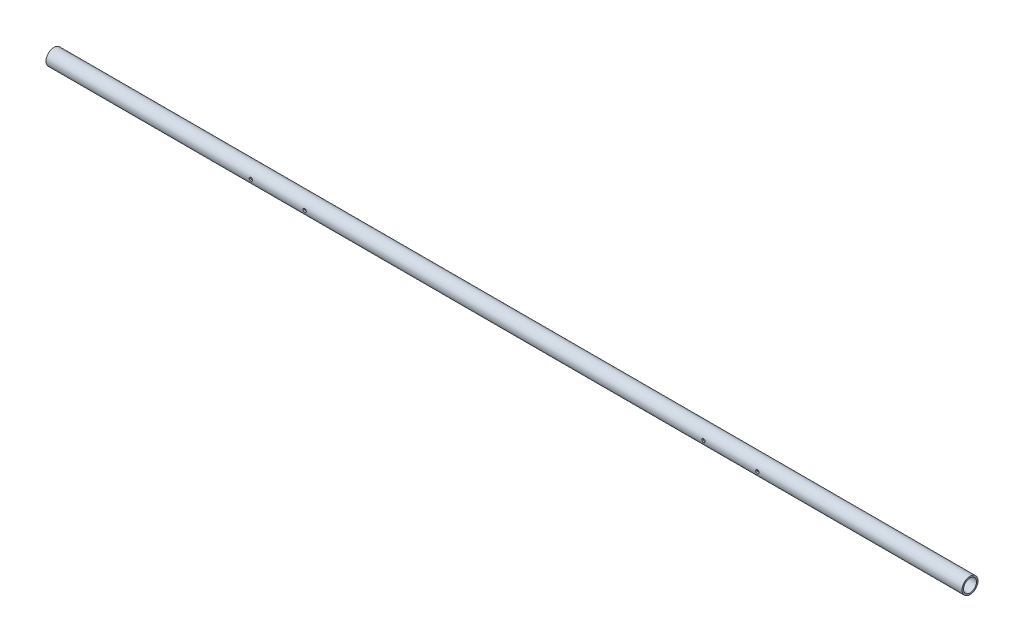
from build123d import *

# Parameters (mm, degrees)
BOSS_EXTRUDE1_DEPTH                 = 215.9
BOSS_EXTRUDE1_DEPTH_BACK            = 215.9
SKETCH1_R                           = 3.7592
SKETCH1_R_2                         = 3.048
CUT_EXTRUDE1_REACH                  = 217.965
CUT_EXTRUDE1_END_RADIUS             = 3.7592
SKETCH2_R                           = 0.777875
CUT_EXTRUDE1_DIRECTION_2_REACH      = 217.965
CUT_EXTRUDE1_DIRECTION_2_END_RADIUS = 3.7592


with BuildPart() as part:
    # Sketch1 → Boss-Extrude1 (new, two sides: drawn at the far end of the back side and taken through both)
    with BuildSketch(Plane(origin=(0, 0, 0), x_dir=(0, 0, -1), z_dir=(1, 0, 0)).offset(-BOSS_EXTRUDE1_DEPTH_BACK)):
        Circle(SKETCH1_R)
        Circle(SKETCH1_R_2, mode=Mode.SUBTRACT)
    extrude(amount=BOSS_EXTRUDE1_DEPTH + BOSS_EXTRUDE1_DEPTH_BACK)

    # Cut-Extrude1: up to this cylinder (the profile starts inside it)
    cut_extrude1_end = Plane(origin=(0, 0, 0), z_dir=(1, 0, 0)) * Cylinder(CUT_EXTRUDE1_END_RADIUS, 683.2084, mode=Mode.PRIVATE)
    # Sketch2 → Cut-Extrude1 (cut, up to the surface)
    with BuildSketch(Plane.XY, mode=Mode.PRIVATE) as cut_extrude1_sk1:
        with Locations((93.98, 0)):
            Circle(SKETCH2_R)
    cut_extrude1_tool1 = extrude(cut_extrude1_sk1.sketch, amount=-CUT_EXTRUDE1_REACH, mode=Mode.PRIVATE) & cut_extrude1_end
    add(cut_extrude1_tool1.solids().sort_by_distance((93.98, 0, 0))[0], mode=Mode.SUBTRACT)
    # Sketch2 → Cut-Extrude1 (cut, up to the surface)
    with BuildSketch(Plane.XY, mode=Mode.PRIVATE) as cut_extrude1_sk2:
        with Locations((119.38, 0)):
            Circle(SKETCH2_R)
    cut_extrude1_tool2 = extrude(cut_extrude1_sk2.sketch, amount=-CUT_EXTRUDE1_REACH, mode=Mode.PRIVATE) & cut_extrude1_end
    add(cut_extrude1_tool2.solids().sort_by_distance((119.38, 0, 0))[0], mode=Mode.SUBTRACT)
    # Sketch2 → Cut-Extrude1 (cut, up to the surface)
    with BuildSketch(Plane.XY, mode=Mode.PRIVATE) as cut_extrude1_sk3:
        with Locations((-119.38, 0)):
            Circle(SKETCH2_R)
    cut_extrude1_tool3 = extrude(cut_extrude1_sk3.sketch, amount=-CUT_EXTRUDE1_REACH, mode=Mode.PRIVATE) & cut_extrude1_end
    add(cut_extrude1_tool3.solids().sort_by_distance((-119.38, 0, 0))[0], mode=Mode.SUBTRACT)
    # Sketch2 → Cut-Extrude1 (cut, up to the surface)
    with BuildSketch(Plane.XY, mode=Mode.PRIVATE) as cut_extrude1_sk4:
        with Locations((-93.98, 0)):
            Circle(SKETCH2_R)
    cut_extrude1_tool4 = extrude(cut_extrude1_sk4.sketch, amount=-CUT_EXTRUDE1_REACH, mode=Mode.PRIVATE) & cut_extrude1_end
    add(cut_extrude1_tool4.solids().sort_by_distance((-93.98, 0, 0))[0], mode=Mode.SUBTRACT)

    # Cut-Extrude1 direction 2: up to this cylinder (the profile starts inside it)
    cut_extrude1_direction_2_end = Plane(origin=(0, 0, 0), z_dir=(1, 0, 0)) * Cylinder(CUT_EXTRUDE1_DIRECTION_2_END_RADIUS, 683.2084, mode=Mode.PRIVATE)
    # Sketch2 → Cut-Extrude1 direction 2 (cut, up to the surface)
    with BuildSketch(Plane.XY, mode=Mode.PRIVATE) as cut_extrude1_direction_2_sk1:
        with Locations((93.98, 0)):
            Circle(SKETCH2_R)
    cut_extrude1_direction_2_tool1 = extrude(cut_extrude1_direction_2_sk1.sketch, amount=CUT_EXTRUDE1_DIRECTION_2_REACH, mode=Mode.PRIVATE) & cut_extrude1_direction_2_end
    add(cut_extrude1_direction_2_tool1.solids().sort_by_distance((93.98, 0, 0))[0], mode=Mode.SUBTRACT)
    # Sketch2 → Cut-Extrude1 direction 2 (cut, up to the surface)
    with BuildSketch(Plane.XY, mode=Mode.PRIVATE) as cut_extrude1_direction_2_sk2:
        with Locations((119.38, 0)):
            Circle(SKETCH2_R)
    cut_extrude1_direction_2_tool2 = extrude(cut_extrude1_direction_2_sk2.sketch, amount=CUT_EXTRUDE1_DIRECTION_2_REACH, mode=Mode.PRIVATE) & cut_extrude1_direction_2_end
    add(cut_extrude1_direction_2_tool2.solids().sort_by_distance((119.38, 0, 0))[0], mode=Mode.SUBTRACT)
    # Sketch2 → Cut-Extrude1 direction 2 (cut, up to the surface)
    with BuildSketch(Plane.XY, mode=Mode.PRIVATE) as cut_extrude1_direction_2_sk3:
        with Locations((-119.38, 0)):
            Circle(SKETCH2_R)
    cut_extrude1_direction_2_tool3 = extrude(cut_extrude1_direction_2_sk3.sketch, amount=CUT_EXTRUDE1_DIRECTION_2_REACH, mode=Mode.PRIVATE) & cut_extrude1_direction_2_end
    add(cut_extrude1_direction_2_tool3.solids().sort_by_distance((-119.38, 0, 0))[0], mode=Mode.SUBTRACT)
    # Sketch2 → Cut-Extrude1 direction 2 (cut, up to the surface)
    with BuildSketch(Plane.XY, mode=Mode.PRIVATE) as cut_extrude1_direction_2_sk4:
        with Locations((-93.98, 0)):
            Circle(SKETCH2_R)
    cut_extrude1_direction_2_tool4 = extrude(cut_extrude1_direction_2_sk4.sketch, amount=CUT_EXTRUDE1_DIRECTION_2_REACH, mode=Mode.PRIVATE) & cut_extrude1_direction_2_end
    add(cut_extrude1_direction_2_tool4.solids().sort_by_distance((-93.98, 0, 0))[0], mode=Mode.SUBTRACT)


solid = part.part
